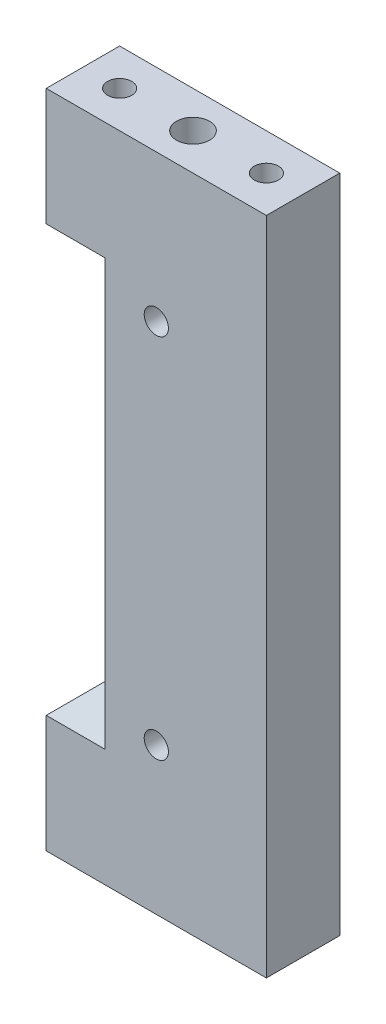
from build123d import *

# Parameters (mm, degrees)
SKETCH1_W                 = 30
SKETCH1_H                 = 10
BOSS_EXTRUDE1_DEPTH       = 90
M4X0_7_TAPPED_HOLE1_D     = 3.3
M4X0_7_TAPPED_HOLE1_DEPTH = 15
M4X0_7_TAPPED_HOLE1_TIP   = 0.991420021
M4X0_7_TAPPED_HOLE2_D     = 3.3
M4X0_7_TAPPED_HOLE2_DEPTH = 15
M4X0_7_TAPPED_HOLE2_TIP   = 0.991420021
M4X0_7_TAPPED_HOLE3_D     = 3.3
M4_CLEARANCE_HOLE1_D      = 4.5
M4_CLEARANCE_HOLE1_DEPTH  = 15
M4_CLEARANCE_HOLE1_TIP    = 1.351936393
SKETCH13_W                = 8
SKETCH13_H                = 50
CUT_EXTRUDE1_DEPTH        = 8
CHAMFER4_SIZE             = 8
CHAMFER5_SIZE             = 4


# Some blends are built 0.0001 mm under size
with BuildPart() as part:
    # Sketch1 → Boss-Extrude1 (new body)
    with BuildSketch(Plane(origin=(0, 0, 0), x_dir=(1, 0, 0), z_dir=(0, 1, 0))):
        Rectangle(SKETCH1_W, SKETCH1_H)
    extrude(amount=BOSS_EXTRUDE1_DEPTH)

    # M4x0.7 Tapped Hole1
    with Locations(Plane(origin=(0, 0, 0), x_dir=(-1, 0, 0), z_dir=(0, -1, 0))):
        with Locations((-10, 0), (10, 0), (0, 0)):
            Hole(M4X0_7_TAPPED_HOLE1_D / 2, depth=M4X0_7_TAPPED_HOLE1_DEPTH)
            with Locations((0, 0, -(M4X0_7_TAPPED_HOLE1_DEPTH + M4X0_7_TAPPED_HOLE1_TIP / 2))):  # 118° drill point
                Cone(0, M4X0_7_TAPPED_HOLE1_D / 2, M4X0_7_TAPPED_HOLE1_TIP, mode=Mode.SUBTRACT)

    # M4x0.7 Tapped Hole2
    with Locations(Plane(origin=(0, 90, 0), x_dir=(1, 0, 0), z_dir=(0, 1, 0))):
        with Locations((-10, 0), (10, 0)):
            Hole(M4X0_7_TAPPED_HOLE2_D / 2, depth=M4X0_7_TAPPED_HOLE2_DEPTH)
            with Locations((0, 0, -(M4X0_7_TAPPED_HOLE2_DEPTH + M4X0_7_TAPPED_HOLE2_TIP / 2))):  # 118° drill point
                Cone(0, M4X0_7_TAPPED_HOLE2_D / 2, M4X0_7_TAPPED_HOLE2_TIP, mode=Mode.SUBTRACT)

    # M4x0.7 Tapped Hole3 (through all)
    with Locations(Plane.XY.offset(5)):
        with Locations((0, 70), (0, 20)):
            Hole(M4X0_7_TAPPED_HOLE3_D / 2)

    # M4 Clearance Hole1
    with Locations(Plane(origin=(0, 90, 0), x_dir=(1, 0, 0), z_dir=(0, 1, 0))):
        with Locations((0, 0)):
            Hole(M4_CLEARANCE_HOLE1_D / 2, depth=M4_CLEARANCE_HOLE1_DEPTH)
            with Locations((0, 0, -(M4_CLEARANCE_HOLE1_DEPTH + M4_CLEARANCE_HOLE1_TIP / 2))):  # 118° drill point
                Cone(0, M4_CLEARANCE_HOLE1_D / 2, M4_CLEARANCE_HOLE1_TIP, mode=Mode.SUBTRACT)

    # Sketch13 → Cut-Extrude1 (cut)
    with BuildSketch(Plane.ZY.offset(15)):
        with Locations((1, 45)):
            Rectangle(SKETCH13_W, SKETCH13_H)
    extrude(amount=-CUT_EXTRUDE1_DEPTH, mode=Mode.SUBTRACT)

    # Chamfer4
    chamfer4_edges = [part.edges().sort_by_distance(p)[0] for p in [
        (-7, 45, -3),
    ]]
    chamfer(chamfer4_edges, length=CHAMFER4_SIZE - 0.0001)  # a hair under: the kernel refuses the full size

    # Chamfer5
    # the kernel refuses this chamfer: 4 mm, written as the material it takes off along each edge
    with BuildSketch(Plane(origin=(-25.286731952, 20, 5), x_dir=(0, -0.9996219169112968, 0.02749587661058627), z_dir=(1, 0, 0))) as chamfer5_piece_1_section:
        Polygon((CHAMFER5_SIZE * 0.999621916911, CHAMFER5_SIZE * 0.0274958766106), (-CHAMFER5_SIZE * 0.0274958766106, CHAMFER5_SIZE * 0.999621916911), (0, 0), align=None)
    chamfer5_piece_1 = extrude(amount=18.286731952, mode=Mode.PRIVATE)
    chamfer5_piece_1 = split(chamfer5_piece_1, bisect_by=Plane(origin=(-9.899926501, 18.600001, 2.099973499), z_dir=(-0.7071067811865476, 0, 0.7071067811865476)), keep=Keep.TOP, mode=Mode.PRIVATE)
    add(chamfer5_piece_1, mode=Mode.SUBTRACT)
    with BuildSketch(Plane(origin=(-15, 20, -3), x_dir=(-0.027495876610586487, -0.9996219169112968, 0), z_dir=(0, 0, 1))) as chamfer5_piece_2_section:
        Polygon((CHAMFER5_SIZE * 0.999621916911, CHAMFER5_SIZE * 0.0274958766106), (-CHAMFER5_SIZE * 0.0274958766106, CHAMFER5_SIZE * 0.999621916911), (0, 0), align=None)
    chamfer5_piece_2 = extrude(amount=18.286731952, mode=Mode.PRIVATE)
    chamfer5_piece_2 = split(chamfer5_piece_2, bisect_by=Plane(origin=(-12.099973499, 18.600001, -0.100073499), z_dir=(-0.7071067811865476, 0, 0.7071067811865476)), keep=Keep.TOP, mode=Mode.PRIVATE)
    add(chamfer5_piece_2, mode=Mode.SUBTRACT)
    with BuildSketch(Plane(origin=(-25.286731952, 70, 5), x_dir=(0, -0.027495876610585623, -0.9996219169112968), z_dir=(1, 0, 0))) as chamfer5_piece_3_section:
        Polygon((CHAMFER5_SIZE * 0.999621916911, CHAMFER5_SIZE * 0.0274958766106), (-CHAMFER5_SIZE * 0.0274958766106, CHAMFER5_SIZE * 0.999621916911), (0, 0), align=None)
    chamfer5_piece_3 = extrude(amount=18.286731952, mode=Mode.PRIVATE)
    chamfer5_piece_3 = split(chamfer5_piece_3, bisect_by=Plane(origin=(-9.899926501, 71.399999, 2.099973499), z_dir=(-0.7071067811865476, 0, 0.7071067811865476)), keep=Keep.TOP, mode=Mode.PRIVATE)
    add(chamfer5_piece_3, mode=Mode.SUBTRACT)
    with BuildSketch(Plane(origin=(-15, 70, 15.286731952), x_dir=(0.9996219169112968, -0.027495876610585623, 0), z_dir=(0, 0, -1))) as chamfer5_piece_4_section:
        Polygon((CHAMFER5_SIZE * 0.999621916911, -CHAMFER5_SIZE * 0.0274958766106), (-CHAMFER5_SIZE * 0.0274958766106, -CHAMFER5_SIZE * 0.999621916911), (0, 0), align=None)
    chamfer5_piece_4 = extrude(amount=18.286731952, mode=Mode.PRIVATE)
    chamfer5_piece_4 = split(chamfer5_piece_4, bisect_by=Plane(origin=(-12.099973499, 71.399999, -0.100073499), z_dir=(-0.7071067811865476, 0, 0.7071067811865476)), keep=Keep.TOP, mode=Mode.PRIVATE)
    add(chamfer5_piece_4, mode=Mode.SUBTRACT)


solid = part.part
